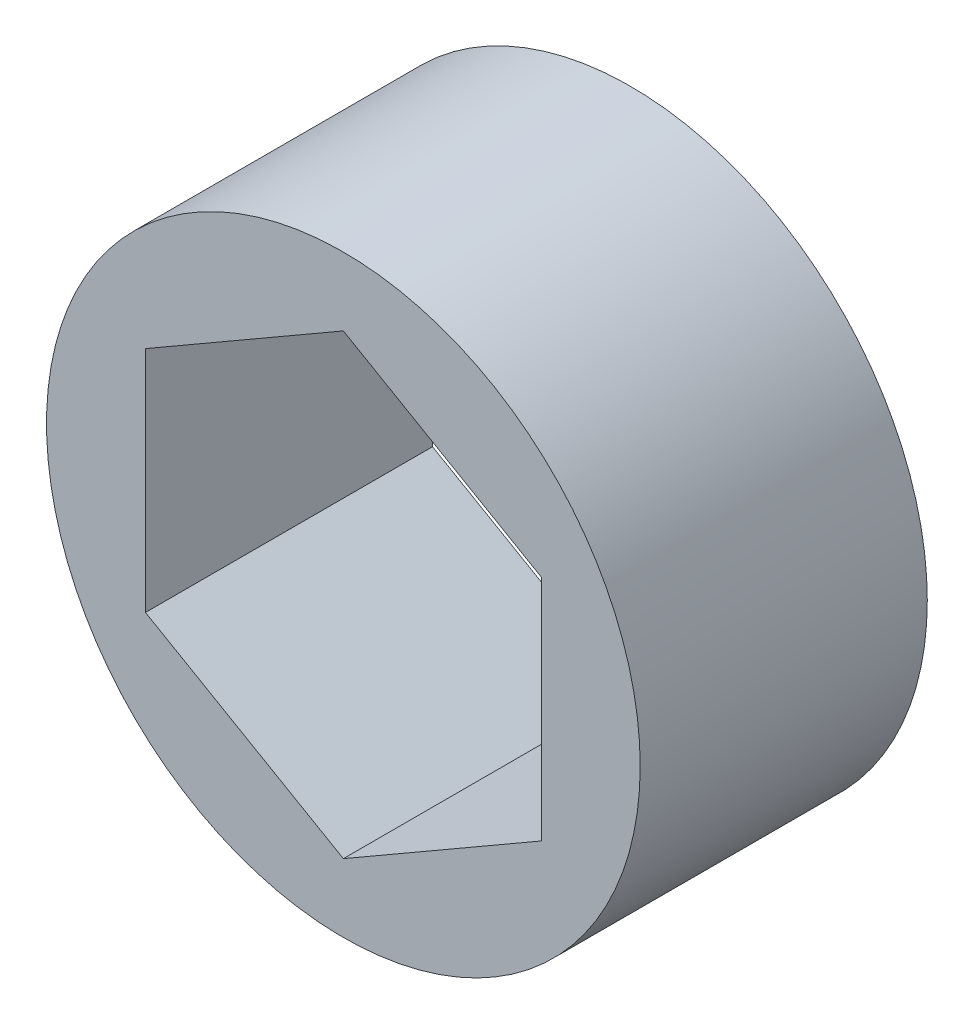
from build123d import *

# Parameters (mm, degrees)
SKETCH1_R           = 9.525
BOSS_EXTRUDE1_DEPTH = 4.606060003


with BuildPart() as part:
    # Sketch1 → Boss-Extrude1 (new, symmetric)
    with BuildSketch(Plane.XY):
        Circle(SKETCH1_R)
        Polygon((0, 7.332348419), (-6.35, 3.666174209), (-6.35, -3.666174209), (0, -7.332348419), (6.35, -3.666174209), (6.35, 3.666174209), align=None, mode=Mode.SUBTRACT)
    extrude(amount=BOSS_EXTRUDE1_DEPTH, both=True)


solid = part.part
